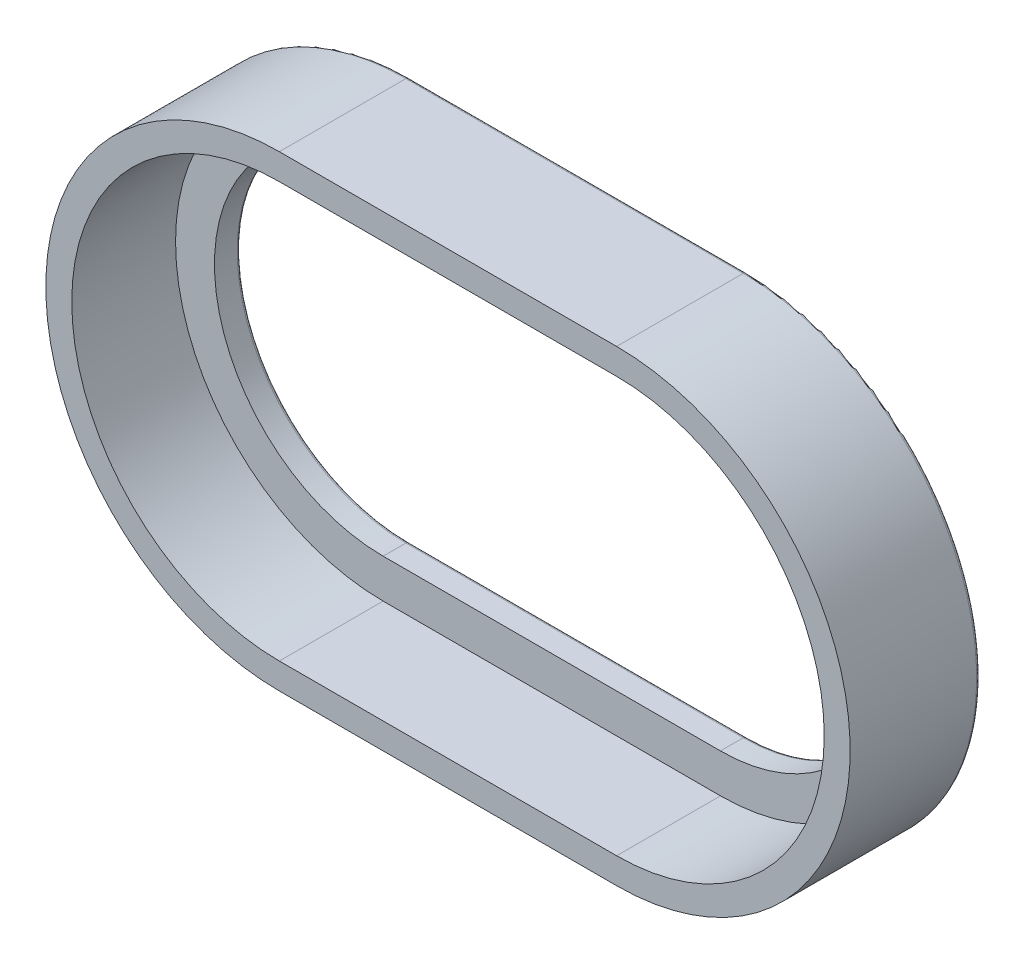
from build123d import *

# Parameters (mm, degrees)
BOSS_EXTRUDE1_DEPTH = 20
BOSS_EXTRUDE2_DEPTH = 4
FILLET1_R           = 0.5


with BuildPart() as part:
    # Sketch1 → Boss-Extrude1 (new body)
    with BuildSketch(Plane.XY):
        with BuildLine():
            Line((52, 36), (0, 36))
            ThreePointArc((0, 36), (-36, 0), (0, -36))
            Line((0, -36), (52, -36))
            ThreePointArc((52, -36), (88, 0), (52, 36))
        make_face()
        with BuildLine():
            ThreePointArc((0, -32), (-32, 0), (0, 32))
            Line((0, 32), (52, 32))
            ThreePointArc((52, 32), (84, 0), (52, -32))
            Line((52, -32), (0, -32))
        make_face(mode=Mode.SUBTRACT)
    extrude(amount=BOSS_EXTRUDE1_DEPTH)

    # Sketch1<3> → Boss-Extrude2 (add)
    with BuildSketch(Plane.XY):
        with BuildLine():
            Line((52, 32), (0, 32))
            ThreePointArc((0, 32), (-32, 0), (0, -32))
            Line((0, -32), (52, -32))
            ThreePointArc((52, -32), (84, 0), (52, 32))
        make_face()
        with BuildLine():
            ThreePointArc((0, -26), (-26, 0), (0, 26))
            Line((0, 26), (52, 26))
            ThreePointArc((52, 26), (78, 0), (52, -26))
            Line((52, -26), (0, -26))
        make_face(mode=Mode.SUBTRACT)
    extrude(amount=BOSS_EXTRUDE2_DEPTH)

    # Fillet1
    fillet1_edges = [part.edges().sort_by_distance(p)[0] for p in [
        (26, -26, 0),
        (-26, 0, 0),
        (26, 26, 0),
        (78, 0, 0),
        (88, 0, 0),
        (26, 36, 0),
        (-36, 0, 0),
        (26, -36, 0),
    ]]
    fillet(fillet1_edges, radius=FILLET1_R)


solid = part.part
